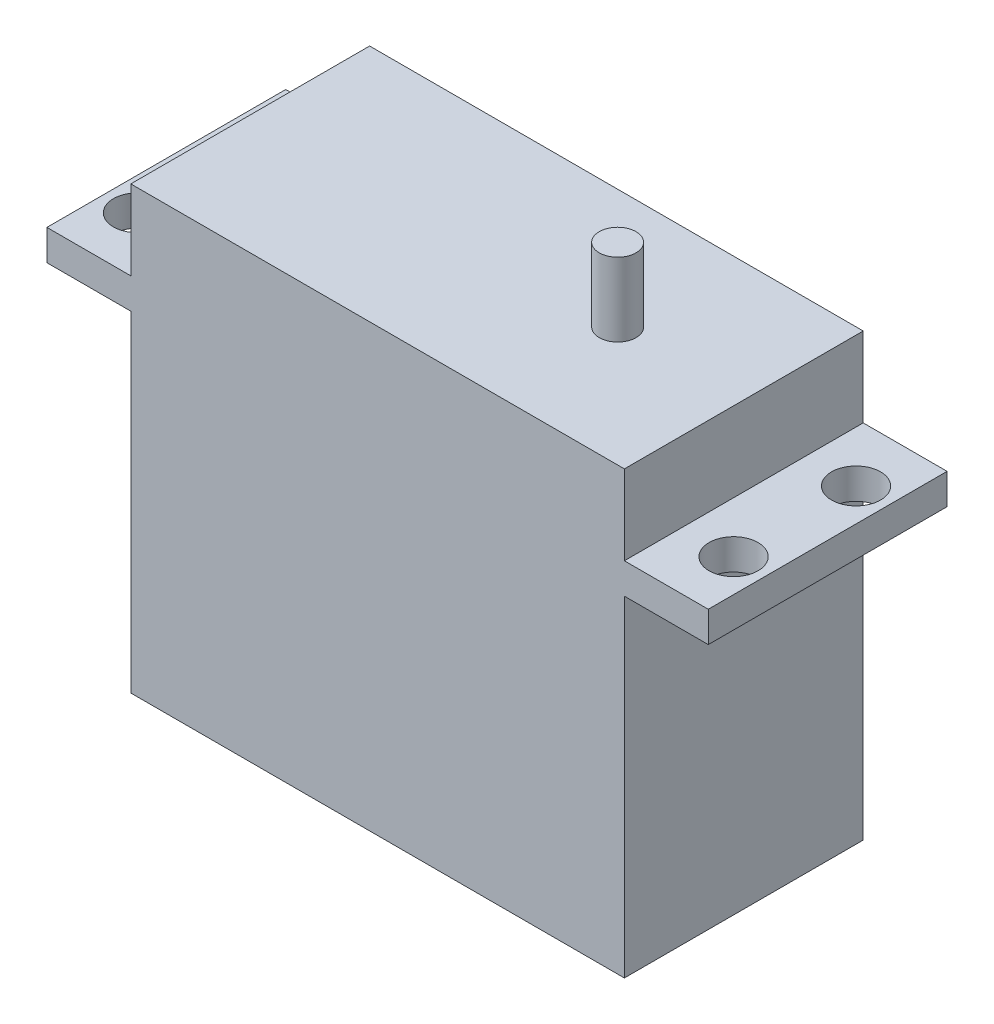
from build123d import *

# Parameters (mm, degrees)
SKETCH1_W               = 40.3
SKETCH1_H               = 19.5
BOSS_EXTRUDE1_DEPTH     = 27
SKETCH2_W               = 54
SKETCH2_H               = 19.5
BOSS_EXTRUDE2_DEPTH     = 2.5
SKETCH3_W               = 40.3
SKETCH3_H               = 19.5
BOSS_EXTRUDE3_DEPTH     = 6.5
SKETCH4_R               = 1.5
BOSS_EXTRUDE4_DEPTH     = 6
CUT_EXTRUDE1_DEPTH      = 42.162027404
CUT_EXTRUDE1_DEPTH_BACK = 42.162027404
SKETCH5_R               = 2


with BuildPart() as part:
    # Sketch1 → Boss-Extrude1 (new body)
    with BuildSketch(Plane(origin=(0, 0, 0), x_dir=(1, 0, 0), z_dir=(0, 1, 0))):
        Rectangle(SKETCH1_W, SKETCH1_H)
    extrude(amount=BOSS_EXTRUDE1_DEPTH)

    # Sketch2 → Boss-Extrude2 (add)
    with BuildSketch(Plane(origin=(0, 27, 0), x_dir=(1, 0, 0), z_dir=(0, 1, 0))):
        Rectangle(SKETCH2_W, SKETCH2_H)
    extrude(amount=BOSS_EXTRUDE2_DEPTH)

    # Sketch3 → Boss-Extrude3 (add)
    with BuildSketch(Plane(origin=(0, 29.5, 0), x_dir=(1, 0, 0), z_dir=(0, 1, 0))):
        Rectangle(SKETCH3_W, SKETCH3_H)
    extrude(amount=BOSS_EXTRUDE3_DEPTH)

    # Sketch4 → Boss-Extrude4 (add)
    with BuildSketch(Plane(origin=(0, 36, 0), x_dir=(1, 0, 0), z_dir=(0, 1, 0))):
        with Locations((9.85, 0)):
            Circle(SKETCH4_R)
    extrude(amount=BOSS_EXTRUDE4_DEPTH)

    # Sketch5 → Cut-Extrude1 (cut, two sides: drawn at the far end of the back side and taken through both)
    with BuildSketch(Plane(origin=(0, 29.5, 0), x_dir=(1, 0, 0), z_dir=(0, 1, 0)).offset(-CUT_EXTRUDE1_DEPTH_BACK)):
        with Locations((-24.315, 5)):
            Circle(SKETCH5_R)
        with Locations((-24.315, -5)):
            Circle(SKETCH5_R)
        with Locations((24.315, -5)):
            Circle(SKETCH5_R)
        with Locations((24.315, 5)):
            Circle(SKETCH5_R)
    extrude(amount=CUT_EXTRUDE1_DEPTH + CUT_EXTRUDE1_DEPTH_BACK, mode=Mode.SUBTRACT)


solid = part.part
